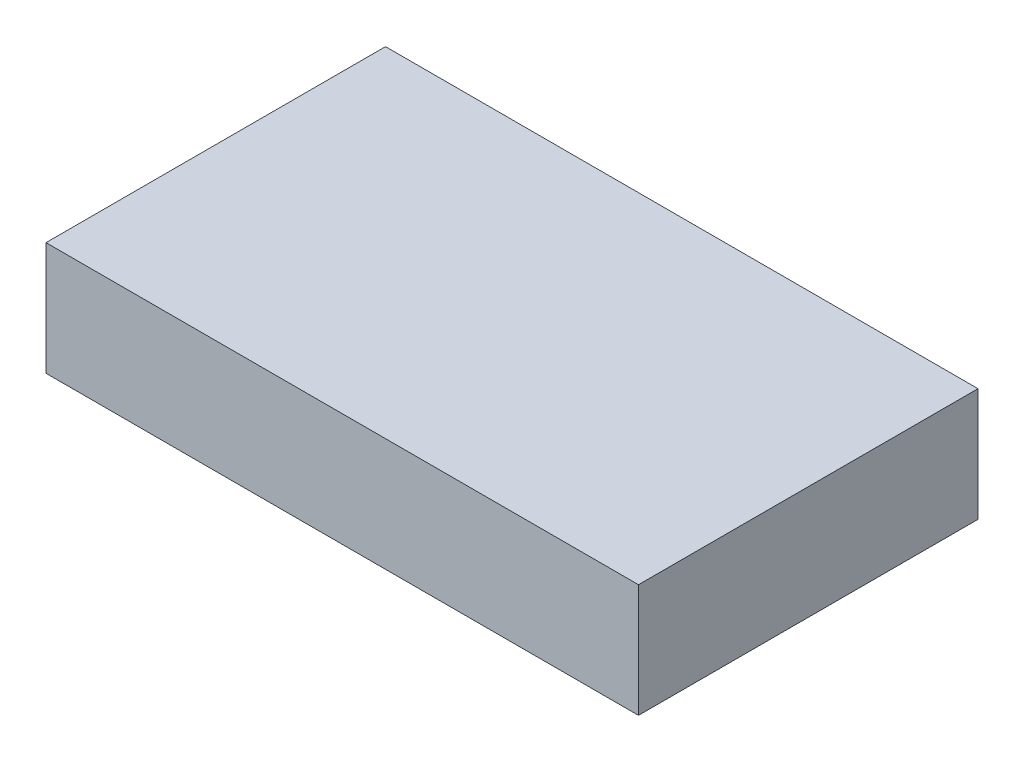
from build123d import *

# Parameters (mm, degrees)
CROQUIS1_W              = 89
CROQUIS1_H              = 51
SALIENTE_EXTRUIR1_DEPTH = 4.6
CROQUIS2_W              = 89
CROQUIS2_H              = 51
SALIENTE_EXTRUIR2_DEPTH = 12.4


with BuildPart() as part:
    # Croquis1 → Saliente-Extruir1 (new body)
    with BuildSketch(Plane(origin=(0, 0, 0), x_dir=(1, 0, 0), z_dir=(0, 1, 0))):
        Rectangle(CROQUIS1_W, CROQUIS1_H)
    extrude(amount=SALIENTE_EXTRUIR1_DEPTH)

    # Croquis2 → Saliente-Extruir2 (add)
    with BuildSketch(Plane(origin=(0, 4.6, 0), x_dir=(1, 0, 0), z_dir=(0, 1, 0))):
        Rectangle(CROQUIS2_W, CROQUIS2_H)
    extrude(amount=SALIENTE_EXTRUIR2_DEPTH)


solid = part.part
